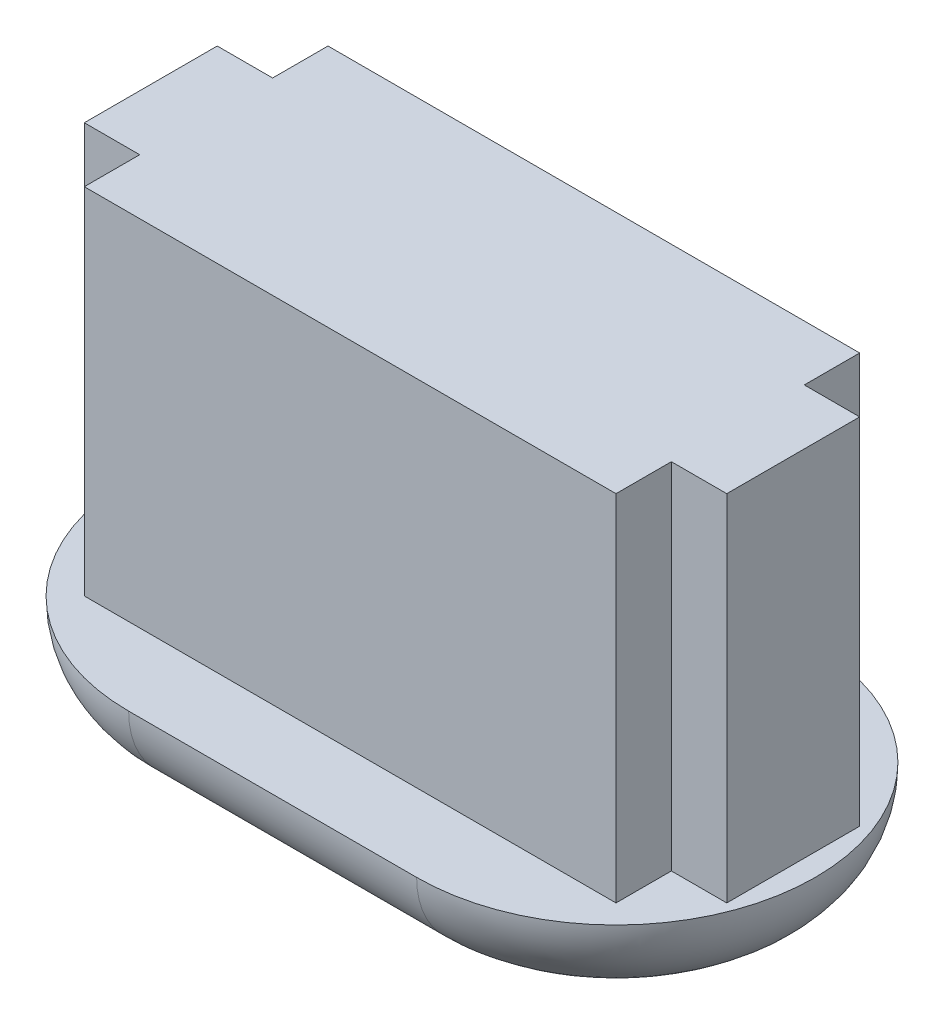
from build123d import *

# Parameters (mm, degrees)
BOSS_EXTRU_1_DEPTH      = 2
CONG_1_R                = 2
BOSS_EXTRU_2_DEPTH      = 8
ENL_V_MAT_EXTRU_1_DEPTH = 5


with BuildPart() as part:
    # Esquisse1 → Boss.-Extru.1 (new body)
    with BuildSketch(Plane(origin=(0, 0, 0), x_dir=(1, 0, 0), z_dir=(0, 1, 0))):
        with BuildLine():
            Line((0, 4.5), (6.5, 4.5))
            ThreePointArc((6.5, 4.5), (11, 0), (6.5, -4.5))
            Line((6.5, -4.5), (0, -4.5))
            ThreePointArc((0, -4.5), (-4.5, 0), (0, 4.5))
        make_face()
    extrude(amount=BOSS_EXTRU_1_DEPTH)

    # Congé1
    cong_1_edges = [part.edges().sort_by_distance(p)[0] for p in [
        (3.25, 0, -4.5),
        (11, 0, 0),
        (-4.5, 0, 0),
        (3.25, 0, 4.5),
    ]]
    fillet(cong_1_edges, radius=CONG_1_R - 0.0001)  # a hair under: the kernel refuses the full size

    # Esquisse2 → Boss.-Extru.2 (add)
    with BuildSketch(Plane(origin=(0, 2, 0), x_dir=(1, 0, 0), z_dir=(0, 1, 0))):
        Polygon((-2.75, -2.75), (9.25, -2.75), (9.25, -1.5), (10.5, -1.5), (10.5, 1.5), (9.25, 1.5), (9.25, 2.75), (-2.75, 2.75), (-2.75, 1.5), (-4, 1.5), (-4, -1.5), (-2.75, -1.5), align=None)
    extrude(amount=BOSS_EXTRU_2_DEPTH)

    # Esquisse4 → Enlèv. mat.-Extru.1 (cut)
    with BuildSketch(Plane.XZ):
        with BuildLine():
            Line((6.5, 1.5), (0, 1.5))
            ThreePointArc((0, 1.5), (-1.5, 0), (0, -1.5))
            Line((0, -1.5), (6.5, -1.5))
            ThreePointArc((6.5, -1.5), (8, 0), (6.5, 1.5))
        make_face()
    extrude(amount=-ENL_V_MAT_EXTRU_1_DEPTH, mode=Mode.SUBTRACT)


solid = part.part
